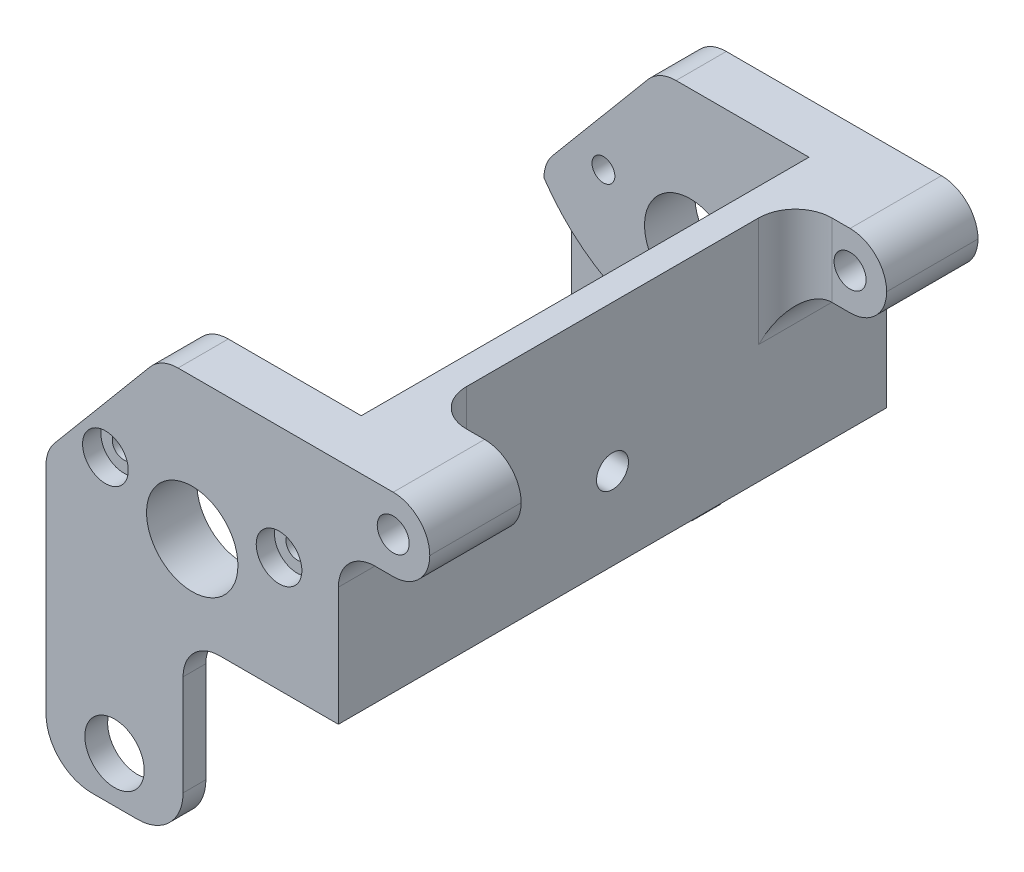
from build123d import *

# Parameters (mm, degrees)
BOSS_EXTRUDE1_DEPTH      = 30
BOSS_EXTRUDE1_DEPTH_BACK = 30
SKETCH2_R                = 3.25
SKETCH2_R_2              = 1.25
SKETCH2_R_3              = 5
SKETCH3_W                = 58
SKETCH3_H                = 55
CUT_EXTRUDE1_DEPTH       = 60.373815778
SKETCH4_W                = 10
SKETCH4_H                = 8
BOSS_EXTRUDE2_DEPTH      = 10
FILLET1_R                = 4
SKETCH5_R                = 1.75
CUT_EXTRUDE2_DEPTH       = 76.599272483
FILLET1_OF_MIRROR1_R     = 4
FILLET2_R                = 4
SKETCH6_R                = 1.25
SKETCH6_R_2              = 5
BOSS_EXTRUDE3_DEPTH      = 3
SKETCH7_R                = 2.5
CUT_EXTRUDE3_DEPTH       = 2
SKETCH8_R                = 1.75
CUT_EXTRUDE4_DEPTH       = 63.841069373


with BuildPart() as part:
    # Sketch2 → Boss-Extrude1 (new, two sides: drawn at the far end of the back side and taken through both)
    with BuildSketch(Plane.XY.offset(-BOSS_EXTRUDE1_DEPTH_BACK)):
        with BuildLine():
            Line((-7.5, 5), (-7.5, 30))
            Line((-7.5, 30), (5.086494468, 45))
            Line((5.086494468, 45), (24.5, 45))
            Line((24.5, 45), (24.5, 20))
            Line((24.5, 20), (7.5, 20))
            Line((7.5, 20), (7.5, 5))
            ThreePointArc((7.5, 5), (6.035533906, 1.464466094), (2.5, 0))
            Line((2.5, 0), (-2.5, 0))
            ThreePointArc((-2.5, 0), (-6.035533906, 1.464466094), (-7.5, 5))
        make_face()
        with Locations((0, 5)):
            Circle(SKETCH2_R, mode=Mode.SUBTRACT)
        with Locations((18.004770913, 32.569673822)):
            Circle(SKETCH2_R_2, mode=Mode.SUBTRACT)
        with Locations((-0.995229087, 32.569673822)):
            Circle(SKETCH2_R_2, mode=Mode.SUBTRACT)
        with Locations((8.504770913, 29.569673822)):
            Circle(SKETCH2_R_3, mode=Mode.SUBTRACT)
    extrude(amount=BOSS_EXTRUDE1_DEPTH + BOSS_EXTRUDE1_DEPTH_BACK)

    # Sketch3 → Cut-Extrude1 (cut, through all)
    with BuildSketch(Plane(origin=(0, 45, 0), x_dir=(1, 0, 0), z_dir=(0, 1, 0))):
        with Locations((-7.5, 0)):
            Rectangle(SKETCH3_W, SKETCH3_H)
    extrude(amount=-CUT_EXTRUDE1_DEPTH, mode=Mode.SUBTRACT)

    # Sketch4 → Boss-Extrude2 (add)
    with BuildSketch(Plane(origin=(24.5, 0, 0), x_dir=(0, 0, -1), z_dir=(1, 0, 0))):
        with Locations((-25, 41)):
            Rectangle(SKETCH4_W, SKETCH4_H)
    boss_extrude2 = extrude(amount=BOSS_EXTRUDE2_DEPTH)

    # Fillet1
    fillet1_edges = [part.edges().sort_by_distance(p)[0] for p in [
        (34.5, 37, 25),
        (34.5, 45, 25),
    ]]
    fillet(fillet1_edges, radius=FILLET1_R - 0.0001)  # a hair under: the kernel refuses the full size

    # Sketch5 → Cut-Extrude2 (cut, through all)
    with BuildSketch(Plane(origin=(0, 0, 20), x_dir=(-1, 0, 0), z_dir=(0, 0, -1))):
        with Locations((-30.5, 41)):
            Circle(SKETCH5_R)
    cut_extrude2 = extrude(amount=-CUT_EXTRUDE2_DEPTH, mode=Mode.SUBTRACT)

    # Mirror1: Boss-Extrude2, Cut-Extrude2 across plane
    add(boss_extrude2.mirror(Plane.XY))
    add(cut_extrude2.mirror(Plane.XY), mode=Mode.SUBTRACT)

    # Fillet1 of Mirror1
    fillet1_of_mirror1_edges = [part.edges().sort_by_distance(p)[0] for p in [
        (34.5, 37, -25),
        (34.5, 45, -25),
    ]]
    fillet(fillet1_of_mirror1_edges, radius=FILLET1_OF_MIRROR1_R - 0.0001)  # a hair under: the kernel refuses the full size

    # Fillet2
    fillet2_edges = [part.edges().sort_by_distance(p)[0] for p in [
        (24.5, 37, 25),
        (24.5, 41, 20),
        (24.5, 37, -25),
        (24.5, 41, -20),
        (5.086494468, 45, -28.75),
        (7.5, 20, -28.75),
        (-7.5, 30, -28.75),
        (-7.5, 30, 28.75),
        (7.5, 20, 28.75),
        (5.086494468, 45, 28.75),
    ]]
    fillet(fillet2_edges, radius=FILLET2_R)

    # Sketch6 → Boss-Extrude3 (add)
    with BuildSketch(Plane.XY.offset(-27.5)):
        with BuildLine():
            Line((21.5, 45), (6.9517251, 45))
            ThreePointArc((6.9517251, 45), (5.261252053, 44.625231148), (3.887547328, 43.571150439))
            Line((3.887547328, 43.571150439), (-6.564177772, 31.115269502))
            ThreePointArc((-6.564177772, 31.115269502), (-7.258770483, 29.912199636), (-7.5, 28.544119063))
            ThreePointArc((-7.5, 28.544119063), (0.776489044, 21.551274863), (11.5, 20))
            Line((11.5, 20), (21.5, 20))
            Line((21.5, 20), (21.5, 45))
        make_face()
        with Locations((18.004770913, 32.569673822)):
            Circle(SKETCH6_R, mode=Mode.SUBTRACT)
        with Locations((8.504770913, 29.569673822)):
            Circle(SKETCH6_R_2, mode=Mode.SUBTRACT)
        with Locations((-0.995229087, 32.569673822)):
            Circle(SKETCH6_R, mode=Mode.SUBTRACT)
    boss_extrude3 = extrude(amount=BOSS_EXTRUDE3_DEPTH)

    # Sketch7 → Cut-Extrude3 (cut)
    with BuildSketch(Plane(origin=(0, 0, -30), x_dir=(-1, 0, 0), z_dir=(0, 0, -1))):
        with Locations((-18.004770913, 32.569673822)):
            Circle(SKETCH7_R)
        with Locations((0.995229087, 32.569673822)):
            Circle(SKETCH7_R)
    cut_extrude3 = extrude(amount=-CUT_EXTRUDE3_DEPTH, mode=Mode.SUBTRACT)

    # Mirror2: Boss-Extrude3, Cut-Extrude3 across plane
    add(boss_extrude3.mirror(Plane.XY))
    add(cut_extrude3.mirror(Plane.XY), mode=Mode.SUBTRACT)

    # Sketch8 → Cut-Extrude4 (cut, through all)
    with BuildSketch(Plane(origin=(24.5, 0, 0), x_dir=(0, 0, -1), z_dir=(1, 0, 0))):
        with Locations(Location((0, 29, 0), (0, 0, 90))):
            Circle(SKETCH8_R)
    extrude(amount=-CUT_EXTRUDE4_DEPTH, mode=Mode.SUBTRACT)


solid = part.part
